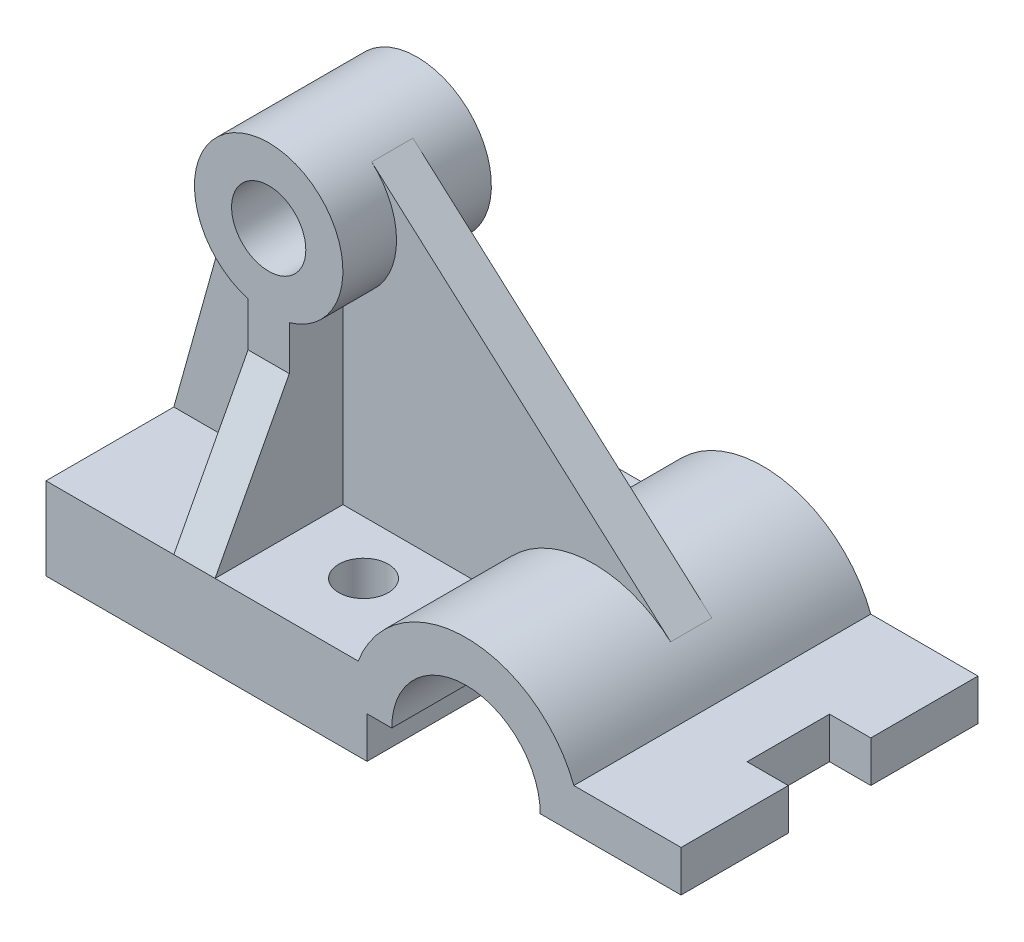
from build123d import *

# Parameters (mm, degrees)
BOSS_EXTRUDE1_DEPTH      = 36
BOSS_EXTRUDE1_DEPTH_BACK = 36
BOSS_EXTRUDE2_DEPTH      = 18
BOSS_EXTRUDE2_DEPTH_BACK = 18
SKETCH2_3_R              = 9
BOSS_EXTRUDE3_DEPTH      = 5
BOSS_EXTRUDE3_DEPTH_BACK = 5
SKETCH2_4_W              = 5
SKETCH2_4_H              = 34
SKETCH3_W                = 10
SKETCH3_H                = 20
CUT_EXTRUDE1_DEPTH       = 178.234308191
RIB1_START               = -5
RIB1_DEPTH               = 10
SKETCH5_R                = 6
CUT_EXTRUDE2_DEPTH       = 178.234308191


# Read off the part's stored shape, not the designer's step: Rib1
with BuildPart() as part:
    # Sketch2 → Boss-Extrude1 (new, two sides: drawn at the far end of the back side and taken through both)
    with BuildSketch(Plane.XY.offset(-BOSS_EXTRUDE1_DEPTH_BACK)):
        with BuildLine():
            Line((0, 20), (0, 0))
            Line((0, 0), (77.846606339, 0))
            Line((77.846606339, 0), (77.846606339, 10))
            Line((77.846606339, 10), (83.846606339, 10))
            ThreePointArc((83.846606339, 10), (101.846606339, 28), (119.846606339, 10))
            Line((119.846606339, 10), (154, 10))
            Line((154, 10), (154, 20))
            Line((154, 20), (128, 20))
            ThreePointArc((128, 20), (124.887273582, 25.909985951), (120.463315732, 30.914543538))
            ThreePointArc((120.463315732, 30.914543538), (95.214697292, 37.203267863), (75.693212678, 20))
            Line((75.693212678, 20), (41, 20))
            Line((41, 20), (31, 20))
            Line((31, 20), (0, 20))
        make_face()
    extrude(amount=BOSS_EXTRUDE1_DEPTH + BOSS_EXTRUDE1_DEPTH_BACK)



with BuildPart() as body_2:
    # Sketch2<3> → Boss-Extrude2 (new, two sides: drawn at the far end of the back side and taken through both)
    with BuildSketch(Plane.XY.offset(-BOSS_EXTRUDE2_DEPTH_BACK)):
        with BuildLine():
            ThreePointArc((47.96788461, 95.445063703), (30.929004292, 99.270929405), (18.663131241, 86.840762505))
            ThreePointArc((18.663131241, 86.840762505), (20.277580459, 73.236123929), (31, 64.708383534))
            Line((31, 64.708383534), (31, 54))
            Line((31, 54), (41, 54))
            Line((41, 54), (41, 64.708383534))
            ThreePointArc((41, 64.708383534), (53.55457644, 78.020446505), (47.96788461, 95.445063703))
        make_face()
        with Locations((36, 82)):
            Circle(SKETCH2_3_R, mode=Mode.SUBTRACT)
    extrude(amount=BOSS_EXTRUDE2_DEPTH + BOSS_EXTRUDE2_DEPTH_BACK)


with BuildPart() as part_1:
    add(part.part)

    add(body_2.part)  # Boss-Extrude3 merges body 2
    # Sketch2<4> → Boss-Extrude3 (add, two sides: drawn at the far end of the back side and taken through both)
    with BuildSketch(Plane.XY.offset(-BOSS_EXTRUDE3_DEPTH_BACK)):
        with BuildLine():
            Line((120.463315732, 30.914543538), (47.96788461, 95.445063703))
            ThreePointArc((47.96788461, 95.445063703), (53.55457644, 78.020446505), (41, 64.708383534))
            Line((41, 64.708383534), (41, 54))
            Line((41, 54), (41, 20))
            Line((41, 20), (75.693212678, 20))
            ThreePointArc((75.693212678, 20), (95.214697292, 37.203267863), (120.463315732, 30.914543538))
        make_face()
        with Locations((33.5, 37)):
            Rectangle(SKETCH2_4_W, SKETCH2_4_H)
        with Locations((38.5, 37)):
            Rectangle(SKETCH2_4_W, SKETCH2_4_H)
        with BuildLine():
            Line((18.663131241, 86.840762505), (0, 20))
            Line((0, 20), (31, 20))
            Line((31, 20), (31, 54))
            Line((31, 54), (31, 64.708383534))
            ThreePointArc((31, 64.708383534), (20.277580459, 73.236123929), (18.663131241, 86.840762505))
        make_face()
    extrude(amount=BOSS_EXTRUDE3_DEPTH + BOSS_EXTRUDE3_DEPTH_BACK)

    # Sketch3 → Cut-Extrude1 (cut, through all)
    with BuildSketch(Plane(origin=(0, 20, 0), x_dir=(1, 0, 0), z_dir=(0, 1, 0))):
        with Locations((149, 0)):
            Rectangle(SKETCH3_W, SKETCH3_H)
    extrude(amount=-CUT_EXTRUDE1_DEPTH, mode=Mode.SUBTRACT)

    # Rib1 outline → Rib1 (add)
    with BuildSketch(Plane.ZY.offset(-36).offset(RIB1_START)):
        Polygon((36, 20), (18, 54), (5, 54), (5, 20), align=None)
    rib1 = extrude(amount=RIB1_DEPTH)

    # Mirror1: Rib1 across plane
    add(rib1.mirror(Plane.XY))

    # Sketch5 → Cut-Extrude2 (cut, through all)
    with BuildSketch(Plane(origin=(0, 20, 0), x_dir=(1, 0, 0), z_dir=(0, 1, 0))):
        with Locations(Location((59, -18, 0), (0, 0, 180))):
            Circle(SKETCH5_R)
        with Locations((59, 18)):
            Circle(SKETCH5_R)
    extrude(amount=-CUT_EXTRUDE2_DEPTH, mode=Mode.SUBTRACT)


solid = part_1.part
